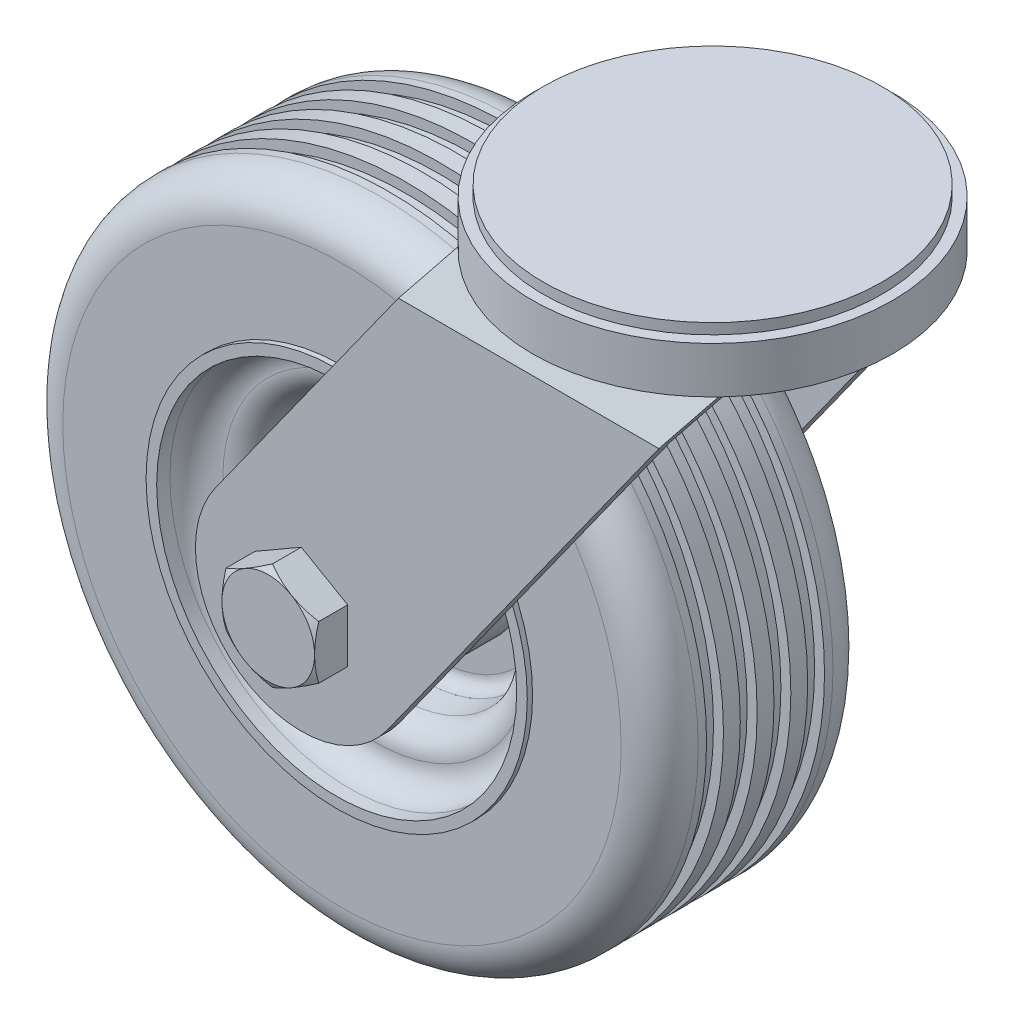
from build123d import *

# Parameters (mm, degrees)
SKETCH1_W               = 117.475
SKETCH1_H               = 4.7625
BOSS_EXTRUDE1_DEPTH     = 50.8
F_1_2_HOLES_DEPTH       = 78.803697293
SKETCH7_W               = 170.933784369
SKETCH7_H               = 70.3072
BOSS_EXTRUDE2_DEPTH     = 164.9349
CUT_EXTRUDE1_START      = -70.3072
CUT_EXTRUDE1_DEPTH      = 70.3072
CUT_EXTRUDE3_DEPTH      = 208.174206511
CUT_EXTRUDE3_DEPTH_BACK = 208.174206511
SKETCH9_OUTSIDE_W       = 162.248
SKETCH9_OUTSIDE_H       = 251.148
BOSS_EXTRUDE3_DEPTH     = 7.9375
SKETCH11_OUTSIDE_W      = 1143.154
SKETCH11_OUTSIDE_H      = 1135.216
SKETCH11_OUTSIDE_R      = 11.1125
CUT_EXTRUDE4_DEPTH      = 255.208337191
CUT_EXTRUDE4_DRAFT      = -60
SKETCH12_R              = 10.795
BOSS_EXTRUDE4_DEPTH     = 64.77
SKETCH13_R              = 101.6
CUT_EXTRUDE5_DEPTH      = 127


# Read off the part's stored shape, not the designer's step: Cut-Extrude1
with BuildPart() as part:
    # Sketch1 → Boss-Extrude1 (new, symmetric)
    with BuildSketch(Plane.XY):
        with Locations((0, -2.38125)):
            Rectangle(SKETCH1_W, SKETCH1_H)
    extrude(amount=BOSS_EXTRUDE1_DEPTH, both=True)

    # Sketch2 → 1-2 holes (cut, through all)
    with BuildSketch(Plane(origin=(0, 0, 0), x_dir=(1, 0, 0), z_dir=(0, 1, 0))):
        with BuildLine():
            Line((-35.649713965, 34.016189941), (-43.587213965, 29.253689941))
            ThreePointArc((-43.587213965, 29.253689941), (-50.121310059, 30.887213965), (-48.487786035, 37.421310059))
            Line((-48.487786035, 37.421310059), (-40.550286035, 42.183810059))
            ThreePointArc((-40.550286035, 42.183810059), (-34.016189941, 40.550286035), (-35.649713965, 34.016189941))
        make_face()
        with BuildLine():
            Line((-35.649713965, -34.016189941), (-43.587213965, -29.253689941))
            ThreePointArc((-43.587213965, -29.253689941), (-50.121310059, -30.887213965), (-48.487786035, -37.421310059))
            Line((-48.487786035, -37.421310059), (-40.550286035, -42.183810059))
            ThreePointArc((-40.550286035, -42.183810059), (-34.016189941, -40.550286035), (-35.649713965, -34.016189941))
        make_face()
        with BuildLine():
            Line((35.649713965, 34.016189941), (43.587213965, 29.253689941))
            ThreePointArc((43.587213965, 29.253689941), (50.121310059, 30.887213965), (48.487786035, 37.421310059))
            Line((48.487786035, 37.421310059), (40.550286035, 42.183810059))
            ThreePointArc((40.550286035, 42.183810059), (34.016189941, 40.550286035), (35.649713965, 34.016189941))
        make_face()
        with BuildLine():
            Line((35.649713965, -34.016189941), (43.587213965, -29.253689941))
            ThreePointArc((43.587213965, -29.253689941), (50.121310059, -30.887213965), (48.487786035, -37.421310059))
            Line((48.487786035, -37.421310059), (40.550286035, -42.183810059))
            ThreePointArc((40.550286035, -42.183810059), (34.016189941, -40.550286035), (35.649713965, -34.016189941))
        make_face()
    extrude(amount=-F_1_2_HOLES_DEPTH, mode=Mode.SUBTRACT)


with BuildPart() as body_2:
    # Sketch4 → Revolve1 (revolve)
    with BuildSketch(Plane.XY, mode=Mode.PRIVATE) as revolve1_sk:
        Polygon((0, -25.5651), (43.18, -25.5651), (43.18, -14.4526), (40.64, -14.4526), (40.64, -11.9126), (44.45, -11.9126), (44.45, -4.7625), (0, -4.7625), align=None)
    revolve(revolve1_sk.sketch.rotate(Axis((0, -4.7625, 0), (0, -1, 0)), 180), axis=Axis((0, -4.7625, 0), (0, -1, 0)))


with BuildPart() as body_3:
    # Sketch6 → Revolve2 (revolve)
    with BuildSketch(Plane(origin=(-63.5, 0, 0), x_dir=(0, 0, -1), z_dir=(1, 0, 0)), mode=Mode.PRIVATE) as revolve2_sk:
        with BuildLine():
            Line((-25.4, -68.58), (-25.4, -47.336363636))
            ThreePointArc((-25.4, -47.336363636), (-22.694731724, -40.805268276), (-16.163636364, -38.1))
            Line((-16.163636364, -38.1), (-14.143181818, -38.1))
            Line((-14.143181818, -38.1), (-14.143181818, -40.48125))
            Line((-14.143181818, -40.48125), (-10.102272727, -40.48125))
            Line((-10.102272727, -40.48125), (-10.102272727, -38.1))
            Line((-10.102272727, -38.1), (-6.061363636, -38.1))
            Line((-6.061363636, -38.1), (-6.061363636, -40.48125))
            Line((-6.061363636, -40.48125), (-2.020454545, -40.48125))
            Line((-2.020454545, -40.48125), (-2.020454545, -38.1))
            Line((-2.020454545, -38.1), (2.020454545, -38.1))
            Line((2.020454545, -38.1), (2.020454545, -40.48125))
            Line((2.020454545, -40.48125), (6.061363636, -40.48125))
            Line((6.061363636, -40.48125), (6.061363636, -38.1))
            Line((6.061363636, -38.1), (10.102272727, -38.1))
            Line((10.102272727, -38.1), (10.102272727, -40.48125))
            Line((10.102272727, -40.48125), (14.143181818, -40.48125))
            Line((14.143181818, -40.48125), (14.143181818, -38.1))
            Line((14.143181818, -38.1), (16.163636364, -38.1))
            ThreePointArc((16.163636364, -38.1), (22.694731724, -40.805268276), (25.4, -47.336363636))
            Line((25.4, -47.336363636), (25.4, -68.58))
            Line((25.4, -68.58), (26.67, -68.58))
            Line((26.67, -68.58), (26.67, -71.12))
            Line((26.67, -71.12), (23.495, -71.12))
            ThreePointArc((23.495, -71.12), (19.004871939, -72.979871939), (17.145, -77.47))
            ThreePointArc((17.145, -77.47), (15.476711089, -81.759997818), (11.348438966, -83.795836333))
            Line((11.348438966, -83.795836333), (5.438280517, -84.312908197))
            ThreePointArc((5.438280517, -84.312908197), (3.374144456, -85.330827454), (2.54, -87.475826363))
            Line((2.54, -87.475826363), (2.54, -93.6625))
            Line((2.54, -93.6625), (26.67, -93.6625))
            Line((26.67, -93.6625), (29.845, -93.6625))
            Line((29.845, -93.6625), (29.845, -114.3))
            Line((29.845, -114.3), (-29.845, -114.3))
            Line((-29.845, -114.3), (-29.845, -93.6625))
            Line((-29.845, -93.6625), (-26.67, -93.6625))
            Line((-26.67, -93.6625), (-2.54, -93.6625))
            Line((-2.54, -93.6625), (-2.54, -87.475826363))
            ThreePointArc((-2.54, -87.475826363), (-3.374144456, -85.330827454), (-5.438280517, -84.312908197))
            Line((-5.438280517, -84.312908197), (-11.348438966, -83.795836333))
            ThreePointArc((-11.348438966, -83.795836333), (-15.476711089, -81.759997818), (-17.145, -77.47))
            ThreePointArc((-17.145, -77.47), (-19.004871939, -72.979871939), (-23.495, -71.12))
            Line((-23.495, -71.12), (-26.67, -71.12))
            Line((-26.67, -71.12), (-26.67, -68.58))
            Line((-26.67, -68.58), (-25.4, -68.58))
        make_face()
    revolve(revolve2_sk.sketch.rotate(Axis((-63.5, -114.3, 111.145303652), (0, 0, -1)), 90), axis=Axis((-63.5, -114.3, 111.145303652), (0, 0, -1)))


with BuildPart() as body_4:
    # Sketch7 → Boss-Extrude2 (new body)
    with BuildSketch(Plane.XZ.offset(25.5651)):
        with Locations((-54.233107816, 0)):
            Rectangle(SKETCH7_W, SKETCH7_H)
    extrude(amount=BOSS_EXTRUDE2_DEPTH)

    # Cut-Extrude1 outline → Cut-Extrude1 (cut)
    with BuildSketch(Plane.XY.offset(35.1536).offset(CUT_EXTRUDE1_START)):
        with BuildLine():
            Line((31.233784369, -25.5651), (-42.844161681, -129.081621811))
            ThreePointArc((-42.844161681, -129.081621811), (-78.281621811, -134.955838319), (-84.155838319, -99.518378189))
            Line((-84.155838319, -99.518378189), (-31.233784369, -25.5651))
            Line((-31.233784369, -25.5651), (-139.7, -25.5651))
            Line((-139.7, -25.5651), (-139.7, -190.5))
            Line((-139.7, -190.5), (31.233784369, -190.5))
            Line((31.233784369, -190.5), (31.233784369, -25.5651))
        make_face()
    extrude(amount=CUT_EXTRUDE1_DEPTH, mode=Mode.SUBTRACT)

    # Sketch9 outside → Cut-Extrude3 (cut, two sides: drawn at the far end of the back side and taken through both)
    with BuildSketch(Plane(origin=(0, -144.306693689, 0), x_dir=(0, 0, -1), z_dir=(-1, 0, 0)).offset(-CUT_EXTRUDE3_DEPTH_BACK)):
        with Locations((0, -49.057)):
            Rectangle(SKETCH9_OUTSIDE_W, SKETCH9_OUTSIDE_H)
        Polygon((35.1536, 46.193306311), (35.1536, -106.206693689), (29.815484467, -118.741593689), (27.046884467, -118.741593689), (32.385, -106.206693689), (32.385, 46.193306311), align=None, mode=Mode.SUBTRACT)
        Polygon((-27.046884467, -118.741593689), (-29.815484467, -118.741593689), (-35.1536, -106.206693689), (-35.1536, 46.193306311), (-32.385, 46.193306311), (-32.385, -106.206693689), align=None, mode=Mode.SUBTRACT)
    extrude(amount=CUT_EXTRUDE3_DEPTH + CUT_EXTRUDE3_DEPTH_BACK, mode=Mode.SUBTRACT)


with BuildPart() as cut_extrude3_piece_1:
    # of the separate pieces the step leaves, piece 1, a body of its own (cut_extrude3_pieces)
    add(body_4.part.solids().sort_by_distance((22.263625503, -38.1, 35.1536))[0])



with BuildPart() as cut_extrude3_piece_2:
    # of the separate pieces the step leaves, piece 2, a body of its own (cut_extrude3_pieces)
    add(body_4.part.solids().sort_by_distance((31.233784369, -25.5651, -29.815484467))[0])


with BuildPart() as body_6:
    # Sketch10 → Boss-Extrude3 (new body)
    with BuildSketch(Plane.XY.offset(35.1536)):
        Polygon((-63.5, -101.468390267), (-74.6125, -107.884195134), (-74.6125, -120.715804866), (-63.5, -127.131609733), (-52.3875, -120.715804866), (-52.3875, -107.884195134), align=None)
    extrude(amount=BOSS_EXTRUDE3_DEPTH)


with BuildPart() as cut_extrude4_tool:
    # Sketch11 outside → Cut-Extrude4 (with draft: the straight prism first)
    with BuildSketch(Plane.XY.offset(43.0911)):
        with Locations((-40.481, -95.25)):
            Rectangle(SKETCH11_OUTSIDE_W, SKETCH11_OUTSIDE_H)
        with Locations((-63.5, -114.3)):
            Circle(SKETCH11_OUTSIDE_R, mode=Mode.SUBTRACT)
    extrude(amount=-CUT_EXTRUDE4_DEPTH)
    # Cut-Extrude4: the draft: its side faces are tilted about the plane it starts from
    cut_extrude4_sides = [cut_extrude4_tool.faces().sort_by_distance(p)[0] for p in [
        (-40.481, -662.858, -84.513068595),
        (531.096, -95.25, -84.513068595),
        (-40.481, 472.358, -84.513068595),
        (-612.058, -95.25, -84.513068595),
        (-74.6125, -114.3, -84.513068595),
    ]]
    draft(cut_extrude4_sides, Plane.XY.offset(43.0911), CUT_EXTRUDE4_DRAFT)


with BuildPart() as body_6_1:
    add(body_6.part)

    # Cut-Extrude4: cut by cut_extrude4_tool
    add(cut_extrude4_tool.part, mode=Mode.SUBTRACT)


with BuildPart() as body_7:
    # Mirror1: mirrored copy
    add(body_6_1.part.mirror(Plane.XY))


with BuildPart() as cut_extrude3_piece_1_1:
    add(cut_extrude3_piece_1.part)

    add(cut_extrude3_piece_2.part)  # Boss-Extrude4 merges Cut-Extrude3 piece 2
    # Sketch12 → Boss-Extrude4 (add)
    with BuildSketch(Plane.XY.offset(-32.385)):
        with Locations(Location((-63.5, -114.3, 0), (0, 0, 180))):
            Circle(SKETCH12_R)
    extrude(amount=BOSS_EXTRUDE4_DEPTH)

    # Combine1: union body 7, body 6, body 2, part
    add(body_7.part)
    add(body_6_1.part)
    add(body_2.part)
    add(part.part)

    # Sketch13 → Cut-Extrude5 (cut)
    with BuildSketch(Plane.XZ.offset(11.9126)):
        Circle(SKETCH13_R)
    extrude(amount=-CUT_EXTRUDE5_DEPTH, mode=Mode.SUBTRACT)


solid = Compound([body_3.part, cut_extrude3_piece_1_1.part])
